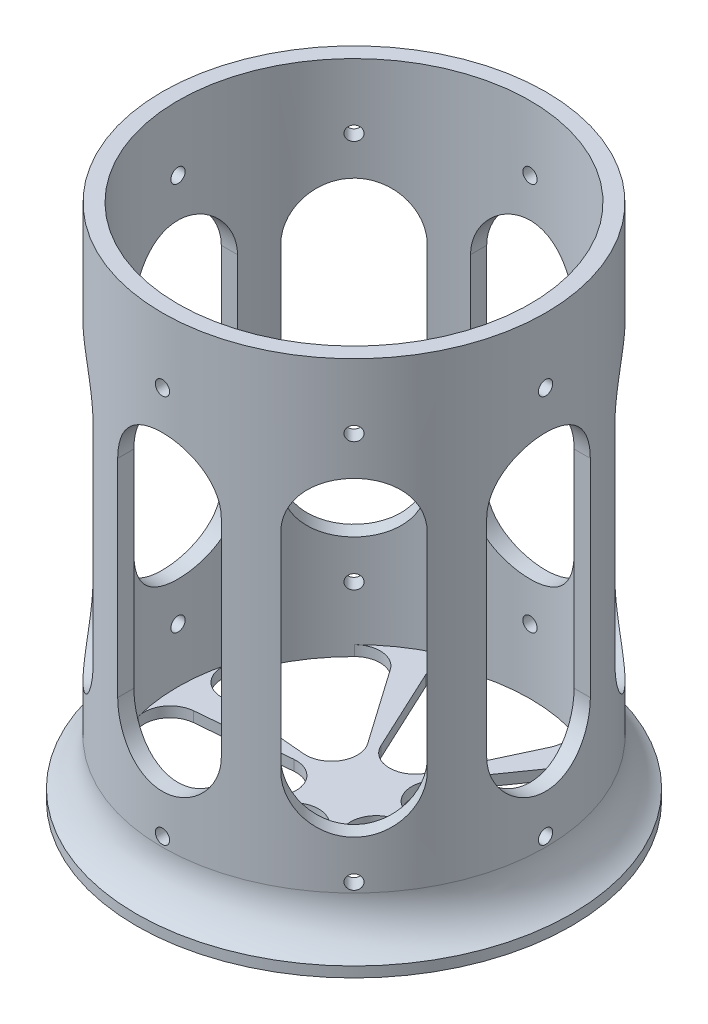
from build123d import *

# Parameters (mm, degrees)
SKETCH2_R                       = 37
SKETCH2_R_2                     = 34
MAIN_EXTRUDE_DEPTH              = 100
SKETCH3_R                       = 1.375
SCREWHOLE_DEPTH                 = 100
WEIGHT_REDUCTION_DEPTH          = 100
SCREWHOLE_PATTERN_COUNT         = 8
SKETCH5_R                       = 42
PLATE_FOR_BETTER_ADHESION_DEPTH = 2
FILLET1_R                       = 10


with BuildPart() as part:
    # Sketch2 → Main extrude (new body)
    with BuildSketch(Plane(origin=(0, 0, 0), x_dir=(1, 0, 0), z_dir=(0, 1, 0))):
        with Locations(Location((0, 0, 0), (0, 0, 270))):
            Circle(SKETCH2_R)
        with Locations(Location((0, 0, 0), (0, 0, 270))):
            Circle(SKETCH2_R_2, mode=Mode.SUBTRACT)
    extrude(amount=MAIN_EXTRUDE_DEPTH)

    # Sketch3 → Screwhole (cut)
    with BuildSketch(Plane.XY):
        with Locations(Location((0, 12.5, 0), (0, 0, 180))):
            Circle(SKETCH3_R)
        with Locations(Location((0, 87.5, 0), (0, 0, 180))):
            Circle(SKETCH3_R)
    screwhole = extrude(amount=SCREWHOLE_DEPTH, mode=Mode.SUBTRACT)

    # Sketch4 → Weight reduction (cut)
    with BuildSketch(Plane.XY):
        with BuildLine():
            Line((10, 70), (10, 30))
            ThreePointArc((10, 30), (0, 20), (-10, 30))
            Line((-10, 30), (-10, 70))
            ThreePointArc((-10, 70), (0, 80), (10, 70))
        make_face()
    weight_reduction = extrude(amount=WEIGHT_REDUCTION_DEPTH, mode=Mode.SUBTRACT)

    # Screwhole pattern: Screwhole, Weight reduction ×8 about axis
    screwhole_pattern_axis = Axis((0, 0, 0), (0, 1, 0))
    add([screwhole.rotate(screwhole_pattern_axis, i * 360 / SCREWHOLE_PATTERN_COUNT) for i in range(1, SCREWHOLE_PATTERN_COUNT)], mode=Mode.SUBTRACT)
    add([weight_reduction.rotate(screwhole_pattern_axis, i * 360 / SCREWHOLE_PATTERN_COUNT) for i in range(1, SCREWHOLE_PATTERN_COUNT)], mode=Mode.SUBTRACT)

    # Sketch5 → Plate for better adhesion (add)
    with BuildSketch(Plane.XZ):
        with Locations(Location((0, 0, 0), (0, 0, 270))):
            Circle(SKETCH5_R)
        with BuildLine():
            Line((-4.531538935, 9.717916607), (-12.072392275, 25.889328781))
            ThreePointArc((-12.072392275, 25.889328781), (-12.073715542, 30.112671321), (-8.841000468, 32.830423554))
            ThreePointArc((-8.841000468, 32.830423554), (0, 34), (8.841000468, 32.830423554))
            ThreePointArc((8.841000468, 32.830423554), (12.073715542, 30.112671321), (12.072392275, 25.889328781))
            Line((12.072392275, 25.889328781), (4.531538935, 9.717916607))
            ThreePointArc((4.531538935, 9.717916607), (0, 6.831007916), (-4.531538935, 9.717916607))
        make_face(mode=Mode.SUBTRACT)
        with BuildLine():
            Line((6.150193186, 8.78338614), (16.384620274, 23.399662786))
            ThreePointArc((16.384620274, 23.399662786), (20.041480568, 25.512480038), (24.011480581, 24.071742777))
            ThreePointArc((24.011480581, 24.071742777), (29.444863729, 17), (32.852481049, 8.758680777))
            ThreePointArc((32.852481049, 8.758680777), (32.115196111, 4.600191283), (28.457012549, 2.489665996))
            Line((28.457012549, 2.489665996), (10.681732121, 0.934530467))
            ThreePointArc((10.681732121, 0.934530467), (5.915826389, 3.415503958), (6.150193186, 8.78338614))
        make_face(mode=Mode.SUBTRACT)
        with BuildLine():
            Line((10.681732121, -0.934530467), (28.457012549, -2.489665996))
            ThreePointArc((28.457012549, -2.489665996), (32.115196111, -4.600191283), (32.852481049, -8.758680777))
            ThreePointArc((32.852481049, -8.758680777), (29.444863729, -17), (24.011480581, -24.071742777))
            ThreePointArc((24.011480581, -24.071742777), (20.041480568, -25.512480038), (16.384620274, -23.399662786))
            Line((16.384620274, -23.399662786), (6.150193186, -8.78338614))
            ThreePointArc((6.150193186, -8.78338614), (5.915826389, -3.415503958), (10.681732121, -0.934530467))
        make_face(mode=Mode.SUBTRACT)
        with BuildLine():
            Line((4.531538935, -9.717916607), (12.072392275, -25.889328781))
            ThreePointArc((12.072392275, -25.889328781), (12.073715542, -30.112671321), (8.841000468, -32.830423554))
            ThreePointArc((8.841000468, -32.830423554), (0, -34), (-8.841000468, -32.830423554))
            ThreePointArc((-8.841000468, -32.830423554), (-12.073715542, -30.112671321), (-12.072392275, -25.889328781))
            Line((-12.072392275, -25.889328781), (-4.531538935, -9.717916607))
            ThreePointArc((-4.531538935, -9.717916607), (0, -6.831007916), (4.531538935, -9.717916607))
        make_face(mode=Mode.SUBTRACT)
        with BuildLine():
            Line((-6.150193186, -8.78338614), (-16.384620274, -23.399662786))
            ThreePointArc((-16.384620274, -23.399662786), (-20.041480568, -25.512480038), (-24.011480581, -24.071742777))
            ThreePointArc((-24.011480581, -24.071742777), (-29.444863729, -17), (-32.852481049, -8.758680777))
            ThreePointArc((-32.852481049, -8.758680777), (-32.115196111, -4.600191283), (-28.457012549, -2.489665996))
            Line((-28.457012549, -2.489665996), (-10.681732121, -0.934530467))
            ThreePointArc((-10.681732121, -0.934530467), (-5.915826389, -3.415503958), (-6.150193186, -8.78338614))
        make_face(mode=Mode.SUBTRACT)
        with BuildLine():
            Line((-10.681732121, 0.934530467), (-28.457012549, 2.489665996))
            ThreePointArc((-28.457012549, 2.489665996), (-32.115196111, 4.600191283), (-32.852481049, 8.758680777))
            ThreePointArc((-32.852481049, 8.758680777), (-29.444863729, 17), (-24.011480581, 24.071742777))
            ThreePointArc((-24.011480581, 24.071742777), (-20.041480568, 25.512480038), (-16.384620274, 23.399662786))
            Line((-16.384620274, 23.399662786), (-6.150193186, 8.78338614))
            ThreePointArc((-6.150193186, 8.78338614), (-5.915826389, 3.415503958), (-10.681732121, 0.934530467))
        make_face(mode=Mode.SUBTRACT)
    extrude(amount=-PLATE_FOR_BETTER_ADHESION_DEPTH)

    # Fillet1
    # the kernel refuses this fillet: 10 mm, written as the material it adds along each edge
    with BuildSketch(Plane(origin=(0, 2, 0), x_dir=(0, 0, 1), z_dir=(1, 0, 0))) as fillet1_piece_1:
        with BuildLine():
            CenterArc((47, -8.660254038), FILLET1_R, 120, 60)
            Line((37, -8.660254038), (36.8, -8.660254038))
            Line((36.8, -8.660254038), (36.8, 0))
            Line((36.8, 0), (37, 0.2))
            ThreePointArc((37, 0.2), (39.5, 0.2), (41.9, 0.173205081))
            Line((41.9, 0.173205081), (42, 0))
        make_face()
    revolve(axis=Axis((0, 2, 0), (0, -1, 0)))


solid = part.part
